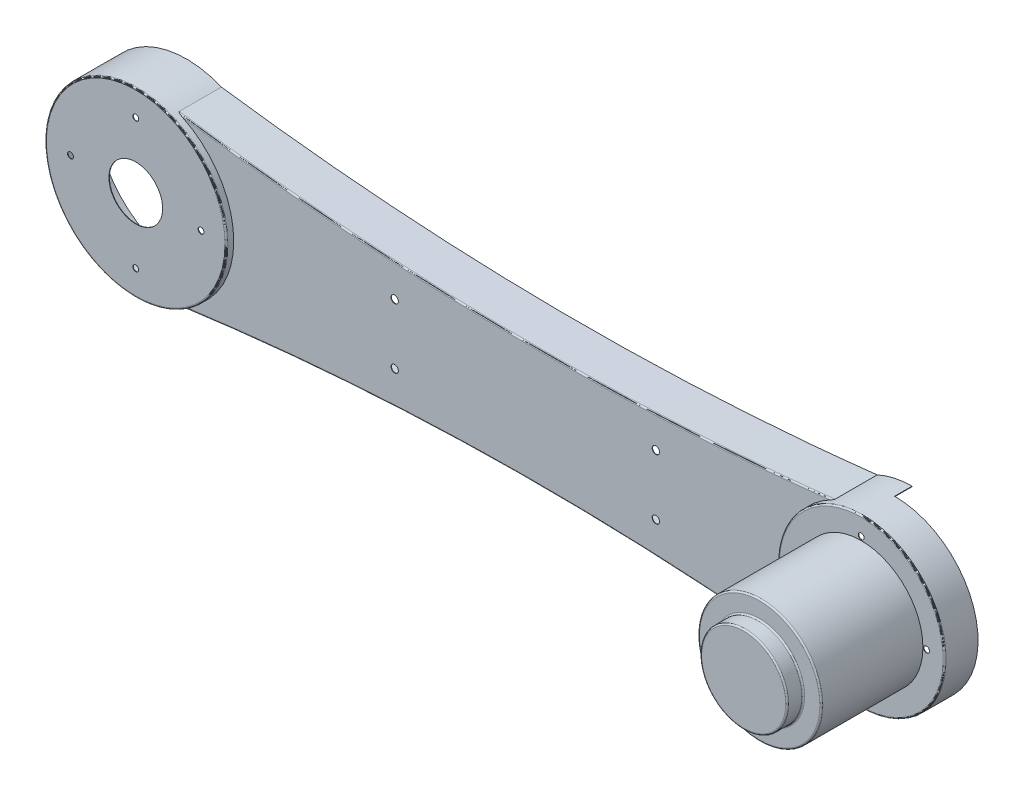
from build123d import *

# Parameters (mm, degrees)
SKETCH1_R                       = 62.5
BOSS_EXTRUDE1_DEPTH             = 35
SKETCH1_R_2                     = 57.5
BOSS_EXTRUDE1_2_DEPTH           = 35
BOSS_EXTRUDE2_DEPTH             = 30
SKETCH8_R                       = 42.5
BOSS_EXTRUDE3_DEPTH             = 70
SKETCH9_R                       = 30
BOSS_EXTRUDE4_DEPTH             = 11
SHELL1_DEPTH                    = 29.7
SHELL1_START                    = 29.7
SHELL1_2_OUTLINE_R              = 42.2
SHELL1_2_DEPTH                  = 75
SHELL1_3_OUTLINE_R              = 62.2
SHELL1_3_OUTLINE_R_2            = 57.2
SHELL1_3_OUTLINE_R_3            = 42.2
SHELL1_3_DEPTH                  = 5
SHELL1_START_2                  = 104.7
SHELL1_4_OUTLINE_R              = 29.7
SHELL1_4_DEPTH                  = 11
FILLET1_R                       = 1
F_4_0MM_DOWEL_HOLE1_D           = 4
F_4_0MM_DOWEL_HOLE1_DEPTH       = 4.798278762
F_4_0MM_DOWEL_HOLE1_CSINK_D     = 4.05
F_4_0MM_DOWEL_HOLE1_CSINK_ANGLE = 90
F_4_0MM_DOWEL_HOLE1_TIP         = 1.201721238
CUT_EXTRUDE1_DEPTH              = 12
SKETCH10_R                      = 18.5
CUT_EXTRUDE2_DEPTH              = 10
SKETCH12_R                      = 2.525
CUT_EXTRUDE3_DEPTH              = 88.6


# Read off the part's stored shape, not the designer's step: Shell1
with BuildPart() as part:
    # Sketch1 → Boss-Extrude1 (new body)
    with BuildSketch(Plane.XY):
        Circle(SKETCH1_R)
    extrude(amount=BOSS_EXTRUDE1_DEPTH)



with BuildPart() as body_2:
    # Sketch1 → Boss-Extrude1 2 (new body)
    with BuildSketch(Plane.XY):
        with Locations((500, 0)):
            Circle(SKETCH1_R_2)
    extrude(amount=BOSS_EXTRUDE1_2_DEPTH)


with BuildPart() as part_1:
    add(part.part)

    add(body_2.part)  # Boss-Extrude2 merges body 2
    # Sketch1<3> → Boss-Extrude2 (add)
    with BuildSketch(Plane.XY):
        with BuildLine():
            ThreePointArc((24, 57.708318291), (51.991585858, 34.686092314), (62.5, 0))
            ThreePointArc((62.5, 0), (51.991585858, -34.686092314), (24, -57.708318291))
            add(Edge.make_bspline(
                [(24, -57.708318291), (249.655903109, -26.361953469), (476, -52.251794228)],
                knots=[0, 0, 0, 1, 1, 1], degree=2))
            ThreePointArc((476, -52.251794228), (442.5, 0), (476, 52.251794228))
            add(Edge.make_bspline(
                [(24, 57.708318291), (249.655903109, 26.361953469), (476, 52.251794228)],
                knots=[0, 0, 0, 1, 1, 1], degree=2))
        make_face()
    extrude(amount=BOSS_EXTRUDE2_DEPTH)

    # Sketch8 → Boss-Extrude3 (add)
    with BuildSketch(Plane.XY.offset(35)):
        with Locations((500, 0)):
            Circle(SKETCH8_R)
    extrude(amount=BOSS_EXTRUDE3_DEPTH)

    # Sketch9 → Boss-Extrude4 (add)
    with BuildSketch(Plane.XY.offset(105)):
        with Locations((500, 0)):
            Circle(SKETCH9_R)
    extrude(amount=BOSS_EXTRUDE4_DEPTH)

    # Shell1 outline → Shell1 (cut)
    with BuildSketch(Plane.XY):
        with BuildLine():
            add(Edge.make_bspline(
                [(23.920417583, 57.416492601), (23.922485156, 57.41620539), (23.92455273, 57.415918179), (23.926620303, 57.415630968), (23.928687876, 57.415343757), (23.93075545, 57.415056545), (23.932823023, 57.414769334), (23.934890597, 57.414482123), (23.93695817, 57.414194912), (23.939025743, 57.4139077), (24.03100309, 57.401130922), (24.120970571, 57.388633851), (24.210808941, 57.376172233), (24.300857358, 57.363663527), (24.390654306, 57.351224794), (24.48067335, 57.338732085), (24.570550448, 57.326283056), (24.660490638, 57.31382161), (24.750413287, 57.301370163), (25.02018849, 57.264028957), (25.200038869, 57.239155014), (25.379889493, 57.214301267), (25.55974036, 57.189467714), (25.739591471, 57.164654357), (25.919442827, 57.139861195), (26.099294427, 57.115088228), (26.27914627, 57.090335456), (26.458998358, 57.065602879), (27.358260016, 56.94204097), (28.077673248, 56.843514565), (28.797090384, 56.745311282), (29.516511425, 56.647431121), (30.23593637, 56.549874082), (30.95536522, 56.452640165), (31.674797974, 56.35572937), (32.394234632, 56.259141697), (33.113675195, 56.162877147), (35.272008596, 55.875052861), (36.710913146, 55.684462492), (38.149833313, 55.495164612), (39.588769095, 55.307159222), (41.027720492, 55.12044632), (42.466687503, 54.935025908), (43.905670128, 54.750897986), (45.344668366, 54.568062554), (46.783682217, 54.386519611), (51.100770605, 53.845768256), (53.978891979, 53.490437314), (56.857075795, 53.140276336), (59.73532205, 52.795285322), (62.613630738, 52.455464275), (65.492001855, 52.120813196), (68.370435396, 51.791332087), (71.248931356, 51.46702095), (74.12748973, 51.147879786), (82.76335208, 50.205966218), (88.520843285, 49.59870374), (94.278584089, 49.012121174), (100.036574451, 48.446218529), (105.794814331, 47.900995817), (111.55330369, 47.376453048), (117.312042488, 46.872590232), (123.071030684, 46.389407379), (128.830268239, 45.9269045), (146.108728862, 44.601435817), (157.62869989, 43.800509997), (169.149667866, 43.082304184), (180.671632455, 42.446818413), (192.194593326, 41.894052721), (203.718550144, 41.424007145), (215.243502577, 41.03668172), (226.769450291, 40.732076484), (238.296392954, 40.510191472), (261.35226751, 40.231861971), (272.881199392, 40.175417482), (284.411125544, 40.201693226), (295.942045633, 40.310689175), (307.473959323, 40.5024053), (319.006866283, 40.776841573), (330.540766177, 41.133997966), (342.075658672, 41.57387445), (353.611543433, 42.096470997), (370.916858474, 43.004445869), (376.685544806, 43.327784161), (382.454479081, 43.671802443), (388.22366126, 44.036500708), (393.993091303, 44.421878944), (399.762769169, 44.827937143), (405.532694819, 45.254675296), (411.302868211, 45.702093393), (417.073289307, 46.170191424), (425.729292445, 46.903358359), (428.61468874, 47.152917318), (431.500146946, 47.407646256), (434.385667059, 47.667545172), (437.271249072, 47.932614064), (440.156892982, 48.202852931), (443.042598784, 48.478261771), (445.928366473, 48.758840583), (448.814196043, 49.044589365), (453.143033214, 49.480967491), (454.585994407, 49.627719359), (456.028971069, 49.775763718), (457.471963198, 49.925100569), (458.914970796, 50.075729912), (460.357993859, 50.227651746), (461.80103239, 50.380866071), (463.244086386, 50.535372886), (464.687155847, 50.691172193), (466.851783236, 50.926809888), (467.573329565, 51.005678909), (468.29487976, 51.084871053), (469.016433821, 51.164386319), (469.737991748, 51.244224708), (470.45955354, 51.324386219), (471.181119199, 51.404870852), (471.902688723, 51.485678609), (472.624262113, 51.566809487), (473.526233682, 51.668626988), (473.706628237, 51.689010684), (473.887023034, 51.709414574), (474.067418073, 51.72983866), (474.247813353, 51.750282941), (474.428208875, 51.770747417), (474.608604639, 51.791232088), (474.789000643, 51.811736954), (474.96939689, 51.832262015), (475.239991622, 51.8630799), (475.330187554, 51.873356964), (475.420401262, 51.883643599), (475.510551597, 51.893919346), (475.60084489, 51.904235332), (475.690914846, 51.914502719), (475.781237891, 51.924833989), (475.871349809, 51.935123256), (475.961591658, 51.945444847), (476.054773048, 51.956103183), (476.057770462, 51.956446035), (476.060767877, 51.956788888), (476.063765291, 51.95713174), (476.066762705, 51.957474592), (476.06976012, 51.957817444), (476.072757534, 51.958160296), (476.075754949, 51.958503149), (476.078752363, 51.958846001), (476.081749777, 51.959188853)],
                knots=[-8.4875e-05, -8.4875e-05, -8.4875e-05, -8.4875e-05, -8.4875e-05, -8.4875e-05, -8.4875e-05, -8.4875e-05, -8.4875e-05, -8.4875e-05, -8.4875e-05, -3.9063e-05, -3.9063e-05, -3.9063e-05, -3.9063e-05, -3.9063e-05, -3.9063e-05, -3.9063e-05, -3.9063e-05, -3.9063e-05, 0.001953125, 0.001953125, 0.001953125, 0.001953125, 0.001953125, 0.001953125, 0.001953125, 0.001953125, 0.001953125, 0.0059375, 0.0059375, 0.0059375, 0.0059375, 0.0059375, 0.0059375, 0.0059375, 0.0059375, 0.0059375, 0.021875, 0.021875, 0.021875, 0.021875, 0.021875, 0.021875, 0.021875, 0.021875, 0.021875, 0.05375, 0.05375, 0.05375, 0.05375, 0.05375, 0.05375, 0.05375, 0.05375, 0.05375, 0.1175, 0.1175, 0.1175, 0.1175, 0.1175, 0.1175, 0.1175, 0.1175, 0.1175, 0.245, 0.245, 0.245, 0.245, 0.245, 0.245, 0.245, 0.245, 0.245, 0.5, 0.5, 0.5, 0.5, 0.5, 0.5, 0.5, 0.5, 0.5, 0.755, 0.755, 0.755, 0.755, 0.755, 0.755, 0.755, 0.755, 0.755, 0.8825, 0.8825, 0.8825, 0.8825, 0.8825, 0.8825, 0.8825, 0.8825, 0.8825, 0.94625, 0.94625, 0.94625, 0.94625, 0.94625, 0.94625, 0.94625, 0.94625, 0.94625, 0.978125, 0.978125, 0.978125, 0.978125, 0.978125, 0.978125, 0.978125, 0.978125, 0.978125, 0.9940625, 0.9940625, 0.9940625, 0.9940625, 0.9940625, 0.9940625, 0.9940625, 0.9940625, 0.9940625, 0.998046875, 0.998046875, 0.998046875, 0.998046875, 0.998046875, 0.998046875, 0.998046875, 0.998046875, 0.998046875, 1.000039062, 1.000039062, 1.000039062, 1.000039062, 1.000039062, 1.000039062, 1.000039062, 1.000039062, 1.000039062, 1.000105276, 1.000105276, 1.000105276, 1.000105276, 1.000105276, 1.000105276, 1.000105276, 1.000105276, 1.000105276, 1.000105276, 1.000105276], degree=10))
            ThreePointArc((23.920417583, 57.416492601), (-62.2, 0), (23.920417583, -57.416492601))
            add(Edge.make_bspline(
                [(23.920417583, -57.416492601), (23.922485156, -57.41620539), (23.92455273, -57.415918179), (23.926620303, -57.415630968), (23.928687876, -57.415343757), (23.93075545, -57.415056545), (23.932823023, -57.414769334), (23.934890597, -57.414482123), (23.93695817, -57.414194912), (23.939025743, -57.4139077), (24.03100309, -57.401130922), (24.120970571, -57.388633851), (24.210808941, -57.376172233), (24.300857358, -57.363663527), (24.390654306, -57.351224794), (24.48067335, -57.338732085), (24.570550448, -57.326283056), (24.660490638, -57.31382161), (24.750413287, -57.301370163), (25.02018849, -57.264028957), (25.200038869, -57.239155014), (25.379889493, -57.214301267), (25.55974036, -57.189467714), (25.739591471, -57.164654357), (25.919442827, -57.139861195), (26.099294427, -57.115088228), (26.27914627, -57.090335456), (26.458998358, -57.065602879), (27.358260016, -56.94204097), (28.077673248, -56.843514565), (28.797090384, -56.745311282), (29.516511425, -56.647431121), (30.23593637, -56.549874082), (30.95536522, -56.452640165), (31.674797974, -56.35572937), (32.394234632, -56.259141697), (33.113675195, -56.162877147), (35.272008596, -55.875052861), (36.710913146, -55.684462492), (38.149833313, -55.495164612), (39.588769095, -55.307159222), (41.027720492, -55.12044632), (42.466687503, -54.935025908), (43.905670128, -54.750897986), (45.344668366, -54.568062554), (46.783682217, -54.386519611), (51.100770605, -53.845768256), (53.978891979, -53.490437314), (56.857075795, -53.140276336), (59.73532205, -52.795285322), (62.613630738, -52.455464275), (65.492001855, -52.120813196), (68.370435396, -51.791332087), (71.248931356, -51.46702095), (74.12748973, -51.147879786), (82.76335208, -50.205966218), (88.520843285, -49.59870374), (94.278584089, -49.012121174), (100.036574451, -48.446218529), (105.794814331, -47.900995817), (111.55330369, -47.376453048), (117.312042488, -46.872590232), (123.071030684, -46.389407379), (128.830268239, -45.9269045), (146.108728862, -44.601435817), (157.62869989, -43.800509997), (169.149667866, -43.082304184), (180.671632455, -42.446818413), (192.194593326, -41.894052721), (203.718550144, -41.424007145), (215.243502577, -41.03668172), (226.769450291, -40.732076484), (238.296392954, -40.510191472), (261.35226751, -40.231861971), (272.881199392, -40.175417482), (284.411125544, -40.201693226), (295.942045633, -40.310689175), (307.473959323, -40.5024053), (319.006866283, -40.776841573), (330.540766177, -41.133997966), (342.075658672, -41.57387445), (353.611543433, -42.096470997), (370.916858474, -43.004445869), (376.685544806, -43.327784161), (382.454479081, -43.671802443), (388.22366126, -44.036500708), (393.993091303, -44.421878944), (399.762769169, -44.827937143), (405.532694819, -45.254675296), (411.302868211, -45.702093393), (417.073289307, -46.170191424), (425.729292445, -46.903358359), (428.61468874, -47.152917318), (431.500146946, -47.407646256), (434.385667059, -47.667545172), (437.271249072, -47.932614064), (440.156892982, -48.202852931), (443.042598784, -48.478261771), (445.928366473, -48.758840583), (448.814196043, -49.044589365), (453.143033214, -49.480967491), (454.585994407, -49.627719359), (456.028971069, -49.775763718), (457.471963198, -49.925100569), (458.914970796, -50.075729912), (460.357993859, -50.227651746), (461.80103239, -50.380866071), (463.244086386, -50.535372886), (464.687155847, -50.691172193), (466.851783236, -50.926809888), (467.573329565, -51.005678909), (468.29487976, -51.084871053), (469.016433821, -51.164386319), (469.737991748, -51.244224708), (470.45955354, -51.324386219), (471.181119199, -51.404870852), (471.902688723, -51.485678609), (472.624262113, -51.566809487), (473.526233682, -51.668626988), (473.706628237, -51.689010684), (473.887023034, -51.709414574), (474.067418073, -51.72983866), (474.247813353, -51.750282941), (474.428208875, -51.770747417), (474.608604639, -51.791232088), (474.789000643, -51.811736954), (474.96939689, -51.832262015), (475.239991622, -51.8630799), (475.330187554, -51.873356964), (475.420401262, -51.883643599), (475.510551597, -51.893919346), (475.60084489, -51.904235332), (475.690914846, -51.914502719), (475.781237891, -51.924833989), (475.871349809, -51.935123256), (475.961591658, -51.945444847), (476.054773048, -51.956103183), (476.057770462, -51.956446035), (476.060767877, -51.956788888), (476.063765291, -51.95713174), (476.066762705, -51.957474592), (476.06976012, -51.957817444), (476.072757534, -51.958160296), (476.075754949, -51.958503149), (476.078752363, -51.958846001), (476.081749777, -51.959188853)],
                knots=[-8.4875e-05, -8.4875e-05, -8.4875e-05, -8.4875e-05, -8.4875e-05, -8.4875e-05, -8.4875e-05, -8.4875e-05, -8.4875e-05, -8.4875e-05, -8.4875e-05, -3.9063e-05, -3.9063e-05, -3.9063e-05, -3.9063e-05, -3.9063e-05, -3.9063e-05, -3.9063e-05, -3.9063e-05, -3.9063e-05, 0.001953125, 0.001953125, 0.001953125, 0.001953125, 0.001953125, 0.001953125, 0.001953125, 0.001953125, 0.001953125, 0.0059375, 0.0059375, 0.0059375, 0.0059375, 0.0059375, 0.0059375, 0.0059375, 0.0059375, 0.0059375, 0.021875, 0.021875, 0.021875, 0.021875, 0.021875, 0.021875, 0.021875, 0.021875, 0.021875, 0.05375, 0.05375, 0.05375, 0.05375, 0.05375, 0.05375, 0.05375, 0.05375, 0.05375, 0.1175, 0.1175, 0.1175, 0.1175, 0.1175, 0.1175, 0.1175, 0.1175, 0.1175, 0.245, 0.245, 0.245, 0.245, 0.245, 0.245, 0.245, 0.245, 0.245, 0.5, 0.5, 0.5, 0.5, 0.5, 0.5, 0.5, 0.5, 0.5, 0.755, 0.755, 0.755, 0.755, 0.755, 0.755, 0.755, 0.755, 0.755, 0.8825, 0.8825, 0.8825, 0.8825, 0.8825, 0.8825, 0.8825, 0.8825, 0.8825, 0.94625, 0.94625, 0.94625, 0.94625, 0.94625, 0.94625, 0.94625, 0.94625, 0.94625, 0.978125, 0.978125, 0.978125, 0.978125, 0.978125, 0.978125, 0.978125, 0.978125, 0.978125, 0.9940625, 0.9940625, 0.9940625, 0.9940625, 0.9940625, 0.9940625, 0.9940625, 0.9940625, 0.9940625, 0.998046875, 0.998046875, 0.998046875, 0.998046875, 0.998046875, 0.998046875, 0.998046875, 0.998046875, 0.998046875, 1.000039062, 1.000039062, 1.000039062, 1.000039062, 1.000039062, 1.000039062, 1.000039062, 1.000039062, 1.000039062, 1.000105276, 1.000105276, 1.000105276, 1.000105276, 1.000105276, 1.000105276, 1.000105276, 1.000105276, 1.000105276, 1.000105276, 1.000105276], degree=10))
            ThreePointArc((476.081749777, -51.959188853), (557.2, 0), (476.081749777, 51.959188853))
        make_face()
    extrude(amount=SHELL1_DEPTH, mode=Mode.SUBTRACT)

    # Shell1 2 outline → Shell1 2 (cut)
    with BuildSketch(Plane.XY.offset(SHELL1_START)):
        with Locations((500, 0)):
            Circle(SHELL1_2_OUTLINE_R)
    extrude(amount=SHELL1_2_DEPTH, mode=Mode.SUBTRACT)

    # Shell1 3 outline → Shell1 3 (cut)
    # profile 1 of 2: a face of its own
    with BuildSketch(Plane.XY.offset(SHELL1_START)):
        Circle(SHELL1_3_OUTLINE_R)
    # profile 2 of 2: a face of its own
    with BuildSketch(Plane.XY.offset(SHELL1_START)):
        with Locations((500, 0)):
            Circle(SHELL1_3_OUTLINE_R_2)
        with Locations((500, 0)):
            Circle(SHELL1_3_OUTLINE_R_3, mode=Mode.SUBTRACT)
    extrude(amount=SHELL1_3_DEPTH, mode=Mode.SUBTRACT)

    # Shell1 4 outline → Shell1 4 (cut)
    with BuildSketch(Plane.XY.offset(SHELL1_START_2)):
        with Locations((500, 0)):
            Circle(SHELL1_4_OUTLINE_R)
    extrude(amount=SHELL1_4_DEPTH, mode=Mode.SUBTRACT)

    # Fillet1
    fillet1_edges = [part_1.edges().sort_by_distance(p)[0] for p in [
        (442.5, 0, 35),
        (457.5, 0, 105),
        (470, 0, 105),
        (470, 0, 116),
        (-62.5, 0, 35),
        (249.827264606, 40.671013157, 30),
        (249.827264606, -40.671013157, 30),
    ]]
    fillet(fillet1_edges, radius=FILLET1_R)

    # Ø4.0mm Dowel Hole1
    with Locations(Plane.XY.offset(35)):
        with Locations((455, 0), (0, 45), (45, 0), (0, -45), (-45, 0), (500, 45), (545, 0), (500, -45)):
            CounterSinkHole(F_4_0MM_DOWEL_HOLE1_D / 2, F_4_0MM_DOWEL_HOLE1_CSINK_D / 2, depth=F_4_0MM_DOWEL_HOLE1_DEPTH, counter_sink_angle=F_4_0MM_DOWEL_HOLE1_CSINK_ANGLE)
            with Locations((0, 0, -(F_4_0MM_DOWEL_HOLE1_DEPTH + F_4_0MM_DOWEL_HOLE1_TIP / 2))):  # 118° drill point
                Cone(0, F_4_0MM_DOWEL_HOLE1_D / 2, F_4_0MM_DOWEL_HOLE1_TIP, mode=Mode.SUBTRACT)

    # Sketch6 → Cut-Extrude1 (cut)
    with BuildSketch(Plane(origin=(0, 0, 0), x_dir=(-1, 0, 0), z_dir=(0, 0, -1))):
        with BuildLine():
            Line((-500, 57.5), (-516.839915758, -54.978788976))
            ThreePointArc((-516.839915758, -54.978788976), (-556.866204226, 8.513801557), (-500, 57.5))
        make_face()
        with BuildLine():
            Line((-606.585636536, 15.133924919), (-625.824150139, -96.552139658))
            ThreePointArc((-625.824150139, -96.552139658), (-663.251096532, -32.60515077), (-606.585636536, 15.133924919))
        make_face()
    extrude(amount=-CUT_EXTRUDE1_DEPTH, mode=Mode.SUBTRACT)

    # Sketch10 → Cut-Extrude2 (cut)
    with BuildSketch(Plane.XY.offset(35)):
        Circle(SKETCH10_R)
    extrude(amount=-CUT_EXTRUDE2_DEPTH, mode=Mode.SUBTRACT)

    # Sketch12 → Cut-Extrude3 (cut)
    with BuildSketch(Plane.XY.offset(30)):
        with Locations((173.431505476, -20.71426162)):
            Circle(SKETCH12_R)
        with Locations((353.431505476, -20.714261618)):
            Circle(SKETCH12_R)
        with Locations((353.431505475, 20.714261625)):
            Circle(SKETCH12_R)
        with Locations((173.431505475, 20.714261623)):
            Circle(SKETCH12_R)
    extrude(amount=-CUT_EXTRUDE3_DEPTH, mode=Mode.SUBTRACT)


solid = part_1.part
